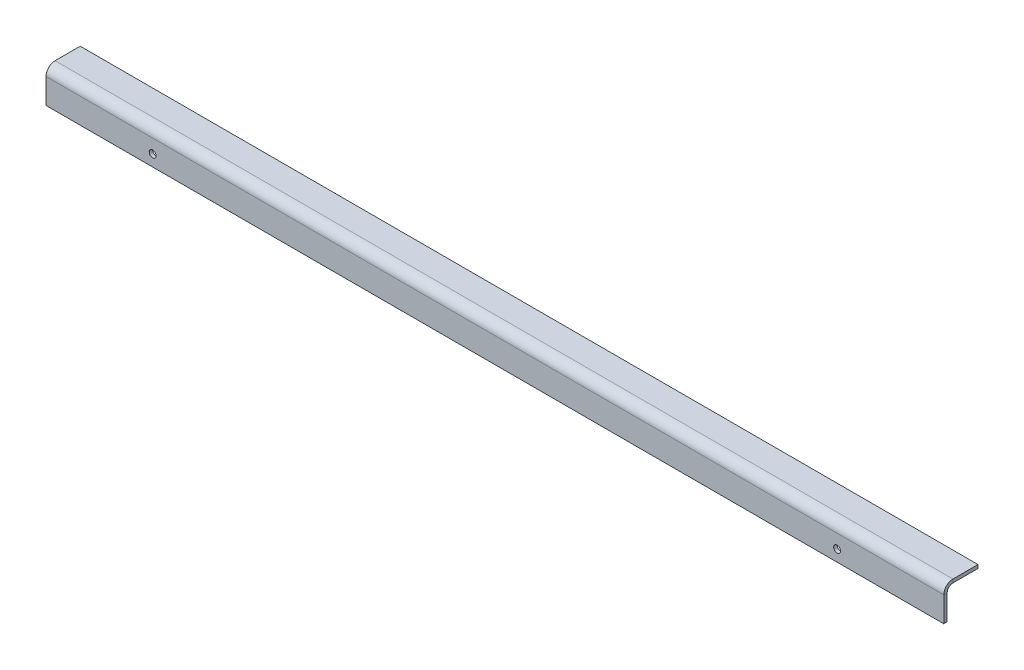
from build123d import *

# Parameters (mm, degrees)
SM_BASE_FLANGE_1_DEPTH = 393.5
SKETCH_3_R             = 3
CUT_EXTRUDE_1_DEPTH    = 396.780557885


# Sheet-metal steps are written as plain solids
with BuildPart() as part:
    # Sketch 1 → Базовая кромка1 (new, symmetric)
    with BuildSketch(Plane(origin=(0, 0, 0), x_dir=(0, 0, -1), z_dir=(1, 0, 0))):
        with BuildLine():
            Line((0, 0), (0, 22))
            ThreePointArc((0, 22), (2.343145751, 27.656854249), (8, 30))
            Line((8, 30), (30, 30))
            Line((30, 30), (30, 27))
            Line((30, 27), (8, 27))
            ThreePointArc((8, 27), (4.464466094, 25.535533906), (3, 22))
            Line((3, 22), (3, 0))
            Line((3, 0), (0, 0))
        make_face()
    extrude(amount=SM_BASE_FLANGE_1_DEPTH, both=True)

    # Эскиз3 → Вырез-Вытянуть1 (cut, through all)
    with BuildSketch(Plane.XY):
        with Locations((300, 10)):
            Circle(SKETCH_3_R)
        with Locations((-300, 10)):
            Circle(SKETCH_3_R)
    extrude(amount=-CUT_EXTRUDE_1_DEPTH, mode=Mode.SUBTRACT)


solid = part.part
